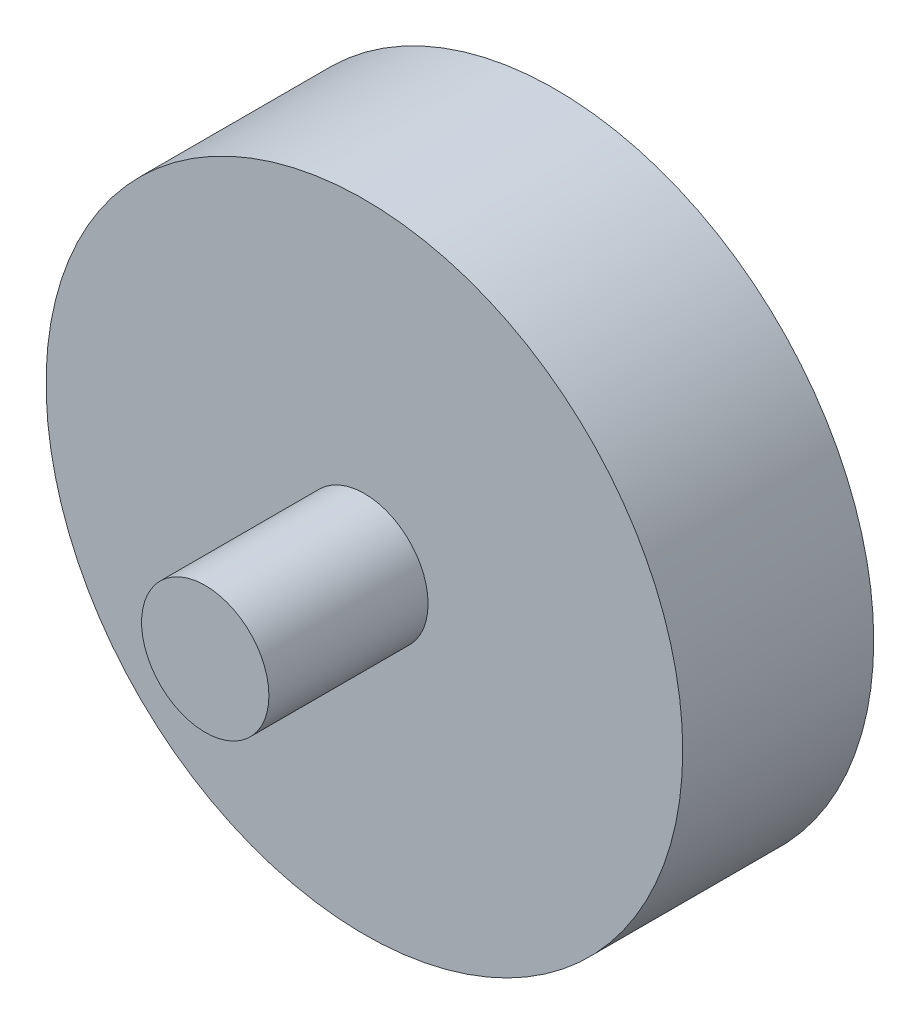
from build123d import *

# Parameters (mm, degrees)
SKETCH1_R          = 20
FOOT_BODY_DEPTH    = 12
SKETCH2_R          = 4
M8_STUD_DEPTH      = 10
SKETCH3_R          = 15
CUT_EXTRUDE1_DEPTH = 1
CHAMFER1_SIZE      = 1


with BuildPart() as part:
    # Sketch1 → FOOT_BODY (new body)
    with BuildSketch(Plane.XY):
        Circle(SKETCH1_R)
    extrude(amount=-FOOT_BODY_DEPTH)

    # Sketch3 → Cut-Extrude1 (cut)
    with BuildSketch(Plane(origin=(0, 0, -12), x_dir=(-1, 0, 0), z_dir=(0, 0, -1))):
        Circle(SKETCH3_R)
    extrude(amount=-CUT_EXTRUDE1_DEPTH, mode=Mode.SUBTRACT)

    # Chamfer1
    chamfer1_edges = [part.edges().sort_by_distance(p)[0] for p in [
        (15, 0, -12),
    ]]
    chamfer(chamfer1_edges, length=CHAMFER1_SIZE - 0.0001)  # a hair under: the kernel refuses the full size


with BuildPart() as body_2:
    # Sketch2 → M8_STUD (new body)
    with BuildSketch(Plane.XY):
        Circle(SKETCH2_R)
    extrude(amount=M8_STUD_DEPTH)


solid = Compound([part.part, body_2.part])
